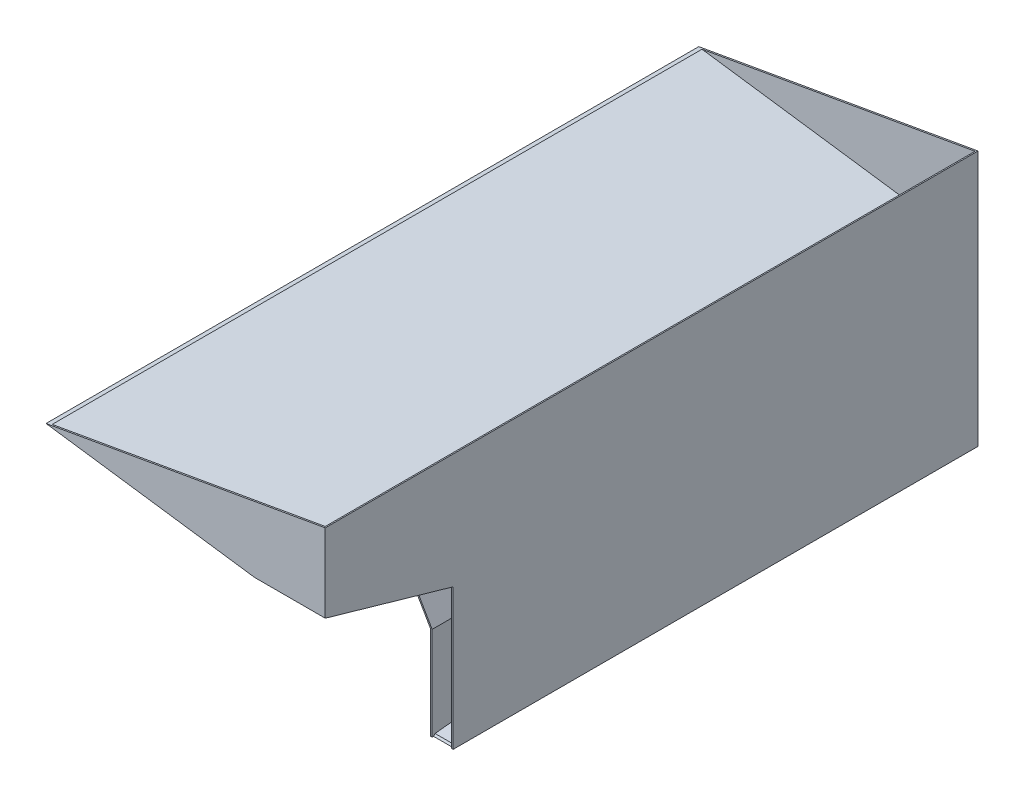
from build123d import *

# Parameters (mm, degrees)
BOSS_EXTRUDE1_DEPTH = 701.675
SHELL1_T            = -3.175
SKETCH3_W           = 42
SKETCH3_H           = 290
CUT_EXTRUDE1_DEPTH  = 20
SKETCH7_W           = 275
SKETCH7_H           = 302.7
CUT_EXTRUDE5_DEPTH  = 100
CUT_EXTRUDE7_DEPTH  = 988.549739455
BOSS_EXTRUDE3_DEPTH = 6.35
BOSS_EXTRUDE4_DEPTH = 42
CHAMFER1_SIZE       = 7.134884114
CHAMFER1_SIZE_2     = 6.35


with BuildPart() as part:
    # Sketch2 → Boss-Extrude1 (new, symmetric)
    with BuildSketch(Plane.XY):
        Polygon((0, 0), (-105, 181.865334795), (-551.988806236, 244.144070894), (48.35, 350), (48.35, -200), (0, -200), align=None)
    extrude(amount=BOSS_EXTRUDE1_DEPTH, both=True)

    # Shell1
    shell1_openings = [part.faces().sort_by_distance(p)[0] for p in [
        (-251.819403118, 297.072035447, 0),
    ]]
    offset(amount=SHELL1_T, openings=shell1_openings, kind=Kind.INTERSECTION)

    # Sketch3 → Cut-Extrude1 (cut)
    with BuildSketch(Plane.XY.offset(701.675)):
        with Locations((24.175, -42.3)):
            Rectangle(SKETCH3_W, SKETCH3_H)
    extrude(amount=-CUT_EXTRUDE1_DEPTH, mode=Mode.SUBTRACT)

    # Sketch7 → Cut-Extrude5 (cut, symmetric)
    with BuildSketch(Plane.ZY):
        with Locations((564.175, -48.65)):
            Rectangle(SKETCH7_W, SKETCH7_H)
    extrude(amount=CUT_EXTRUDE5_DEPTH, both=True, mode=Mode.SUBTRACT)

    # Sketch9 → Cut-Extrude7 (cut, through all)
    with BuildSketch(Plane(origin=(48.35, 0, 0), x_dir=(0, 0, -1), z_dir=(1, 0, 0))):
        Polygon((-701.675, 102.7), (-426.675, 102.7), (-701.675, 181.7), align=None)
    extrude(amount=-CUT_EXTRUDE7_DEPTH, mode=Mode.SUBTRACT)

    # Sketch11 → Boss-Extrude3 (add)
    with BuildSketch(Plane(origin=(0, -18.35715529, 5.273510065), x_dir=(1, 0, 0), z_dir=(0, -0.9611272890955623, 0.27610565759472516))):
        Polygon((48.35, 724.567388561), (48.35, 438.44503711), (-59.293872646, 438.44503711), (-104.904543912, 724.567388561), align=None)
    extrude(amount=-BOSS_EXTRUDE3_DEPTH)

    # Sketch12 → Boss-Extrude4 (add)
    with BuildSketch(Plane(origin=(3.175, 0, 0), x_dir=(0, 0, -1), z_dir=(1, 0, 0))):
        Polygon((688.975, -79.565459926), (-396.466892858, -193.65), (-396.466892858, -196.825), (688.975, -82.740459926), align=None)
        Polygon((-396.466892858, -193.65), (-426.675, -196.825), (-396.466892858, -196.825), align=None)
    extrude(amount=BOSS_EXTRUDE4_DEPTH)

    # Chamfer1
    # the kernel refuses this chamfer: 7.134884114, 6.35 mm, written as the material it takes off along each edge
    with BuildSketch(Plane(origin=(3.175, -196.825, 426.675), x_dir=(0, -0.9997021141585574, 0.02440661686737172), z_dir=(1, 0, 0))) as chamfer1_piece_1:
        Polygon((CHAMFER1_SIZE * 0.999702114118, CHAMFER1_SIZE * 0.0244066168664), (-CHAMFER1_SIZE_2 * 0.128770240585, CHAMFER1_SIZE_2 * 0.991674455222), (0, 0), align=None)
    extrude(amount=42, mode=Mode.SUBTRACT)


solid = part.part
